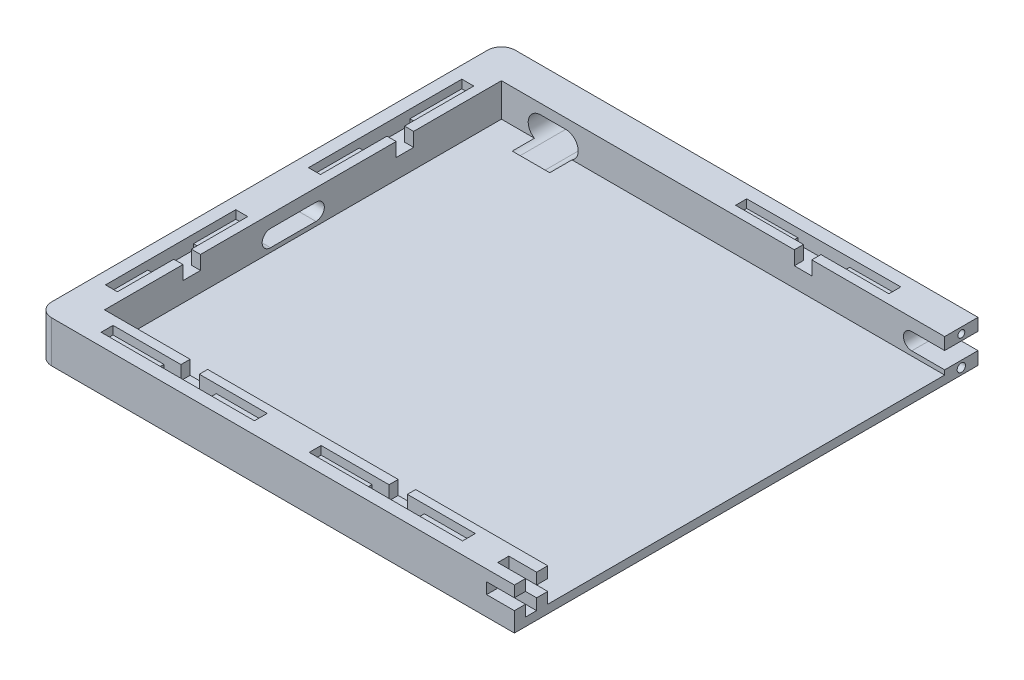
from build123d import *

# Parameters (mm, degrees)
SKETCH1_W           = 159.54
SKETCH1_H           = 142.875
BOSS_EXTRUDE1_DEPTH = 3
BOSS_EXTRUDE2_DEPTH = 15
CUT_EXTRUDE1_DEPTH  = 3
CUT_EXTRUDE2_DEPTH  = 2
CUT_EXTRUDE3_DEPTH  = 12
CUT_EXTRUDE5_DEPTH  = 12
CUT_EXTRUDE6_DEPTH  = 20
CUT_EXTRUDE8_DEPTH  = 10
FILLET2_R           = 5
FILLET3_R           = 5
SKETCH11_R          = 1.5
SKETCH11_R_2        = 1.25
CUT_EXTRUDE9_DEPTH  = 10


with BuildPart() as part:
    # Sketch1 → Boss-Extrude1 (new body)
    with BuildSketch(Plane(origin=(0, 0, 0), x_dir=(1, 0, 0), z_dir=(0, 1, 0))):
        with Locations((-79.77, 0)):
            Rectangle(SKETCH1_W, SKETCH1_H)
    extrude(amount=BOSS_EXTRUDE1_DEPTH)

    # Sketch2 → Boss-Extrude2 (add)
    with BuildSketch(Plane(origin=(0, 0, 0), x_dir=(1, 0, 0), z_dir=(0, 1, 0))):
        Polygon((0, 71.4375), (0, 83.4375), (-171.54, 83.4375), (-171.54, -83.4375), (0, -83.4375), (0, -71.4375), (-159.54, -71.4375), (-159.54, 71.4375), align=None)
    extrude(amount=BOSS_EXTRUDE2_DEPTH)

    # Sketch3 → Cut-Extrude1 (cut)
    with BuildSketch(Plane(origin=(0, 15, 0), x_dir=(1, 0, 0), z_dir=(0, 1, 0))):
        Polygon((-159.54, 39.8375), (-159.54, 33.5375), (-162.84, 33.5375), (-162.84, 9.588405135), (-167.14, 9.588405135), (-167.14, 64.788405135), (-162.84, 64.788405135), (-162.84, 39.8375), align=None)
        Polygon((-23.07, -74.4375), (-47.52, -74.4375), (-47.52, -71.4375), (-53.82, -71.4375), (-53.82, -74.7375), (-78.27, -74.7375), (-78.27, -79.0375), (-23.07, -79.0375), align=None)
        Polygon((-159.54, -36.8875), (-159.54, -43.1875), (-162.84, -43.1875), (-162.84, -63.4875), (-167.14, -63.4875), (-167.14, -16.5875), (-162.84, -16.5875), (-162.84, -36.8875), align=None)
        Polygon((-97.97, -79.0375), (-97.97, -74.4375), (-122.42, -74.4375), (-122.42, -71.4375), (-128.72, -71.4375), (-128.72, -74.7375), (-153.17, -74.7375), (-153.17, -79.0375), align=None)
        Polygon((-47.82, 74.7375), (-47.82, 71.4375), (-54.12, 71.4375), (-54.12, 74.735860656), (-78.569995521, 74.735860656), (-78.569995521, 78.735860656), (-23.370819678, 79.037499922), (-23.37, 74.7375), align=None)
    extrude(amount=-CUT_EXTRUDE1_DEPTH, mode=Mode.SUBTRACT)

    # Sketch4 → Cut-Extrude2 (cut)
    with BuildSketch(Plane(origin=(0, 12, 0), x_dir=(1, 0, 0), z_dir=(0, 1, 0))):
        Polygon((-54.12, 74.735860656), (-54.12, 71.4375), (-47.82, 71.4375), (-47.82, 74.7375), (-41.7075, 74.7375), (-41.7075, 78.937298013), (-60.23249888, 78.836067026), (-60.23249888, 74.735860656), align=None)
        Polygon((-159.54, 39.8375), (-159.54, 33.5375), (-162.84, 33.5375), (-162.84, 27.850226284), (-167.14, 27.850226284), (-167.14, 46.075226284), (-162.84, 46.075226284), (-162.84, 39.8375), align=None)
        Polygon((-167.14, -31.8125), (-167.14, -48.2625), (-162.84, -48.2625), (-162.84, -43.1875), (-159.54, -43.1875), (-159.54, -36.8875), (-162.84, -36.8875), (-162.84, -31.8125), align=None)
        Polygon((-128.72, -71.4375), (-128.72, -74.7375), (-134.8325, -74.7375), (-134.8325, -79.0375), (-116.3075, -79.0375), (-116.3075, -74.4375), (-122.42, -74.4375), (-122.42, -71.4375), align=None)
        Polygon((-53.82, -74.7375), (-59.9325, -74.7375), (-59.9325, -79.0375), (-41.4075, -79.0375), (-41.4075, -74.4375), (-47.52, -74.4375), (-47.52, -71.4375), (-53.82, -71.4375), align=None)
    extrude(amount=-CUT_EXTRUDE2_DEPTH, mode=Mode.SUBTRACT)

    # Sketch5 → Cut-Extrude3 (cut)
    with BuildSketch(Plane.ZY.offset(171.54)):
        with BuildLine():
            Line((-4.6875, 10.5), (11.6925, 10.5))
            ThreePointArc((11.6925, 10.5), (14.6925, 7.5), (11.6925, 4.5))
            Line((11.6925, 4.5), (-4.6875, 4.5))
            ThreePointArc((-4.6875, 4.5), (-7.6875, 7.5), (-4.6875, 10.5))
        make_face()
    extrude(amount=-CUT_EXTRUDE3_DEPTH, mode=Mode.SUBTRACT)

    # Sketch7 → Cut-Extrude5 (cut)
    with BuildSketch(Plane(origin=(0, 0, -83.4375), x_dir=(-1, 0, 0), z_dir=(0, 0, -1))):
        with BuildLine():
            Line((-4.5375, 10.634328206), (11.8425, 10.634328206))
            ThreePointArc((11.8425, 10.634328206), (14.8425, 7.634328206), (11.8425, 4.634328206))
            Line((11.8425, 4.634328206), (-4.5375, 4.634328206))
            ThreePointArc((-4.5375, 4.634328206), (-7.5375, 7.634328206), (-4.5375, 10.634328206))
        make_face()
    extrude(amount=-CUT_EXTRUDE5_DEPTH, mode=Mode.SUBTRACT)

    # Sketch8 → Cut-Extrude6 (cut)
    with BuildSketch(Plane(origin=(0, 0, -83.4375), x_dir=(-1, 0, 0), z_dir=(0, 0, -1))):
        with BuildLine():
            Line((136.4, 11.4), (145.4, 11.4))
            ThreePointArc((145.4, 11.4), (149.9, 6.9), (145.4, 2.4))
            Line((145.4, 2.4), (136.4, 2.4))
            ThreePointArc((136.4, 2.4), (131.9, 6.9), (136.4, 11.4))
        make_face()
    extrude(amount=-CUT_EXTRUDE6_DEPTH, mode=Mode.SUBTRACT)

    # Sketch10 → Cut-Extrude8 (cut)
    with BuildSketch(Plane(origin=(0, 0, 0), x_dir=(0, 0, -1), z_dir=(1, 0, 0))):
        Polygon((-79.4375, 15), (-75.4375, 15), (-75.4375, 11), (-71.4375, 11), (-71.4375, 7), (-75.4375, 7), (-75.4375, 3), (-79.4375, 3), (-79.4375, 7), (-83.4375, 7), (-83.4375, 11), (-79.4375, 11), align=None)
    extrude(amount=-CUT_EXTRUDE8_DEPTH, mode=Mode.SUBTRACT)

    # Fillet2
    fillet2_edges = [part.edges().sort_by_distance(p)[0] for p in [
        (-171.54, 7.5, 83.4375),
    ]]
    fillet(fillet2_edges, radius=FILLET2_R)

    # Fillet3
    fillet3_edges = [part.edges().sort_by_distance(p)[0] for p in [
        (-171.54, 7.5, -83.4375),
    ]]
    fillet(fillet3_edges, radius=FILLET3_R)

    # Sketch11 → Cut-Extrude9 (cut)
    with BuildSketch(Plane(origin=(0, 0, 0), x_dir=(0, 0, -1), z_dir=(1, 0, 0))):
        with Locations((77.4375, 2.317164103)):
            Circle(SKETCH11_R)
        with Locations((77.4375, 12.817164103)):
            Circle(SKETCH11_R_2)
    extrude(amount=-CUT_EXTRUDE9_DEPTH, mode=Mode.SUBTRACT)


solid = part.part
